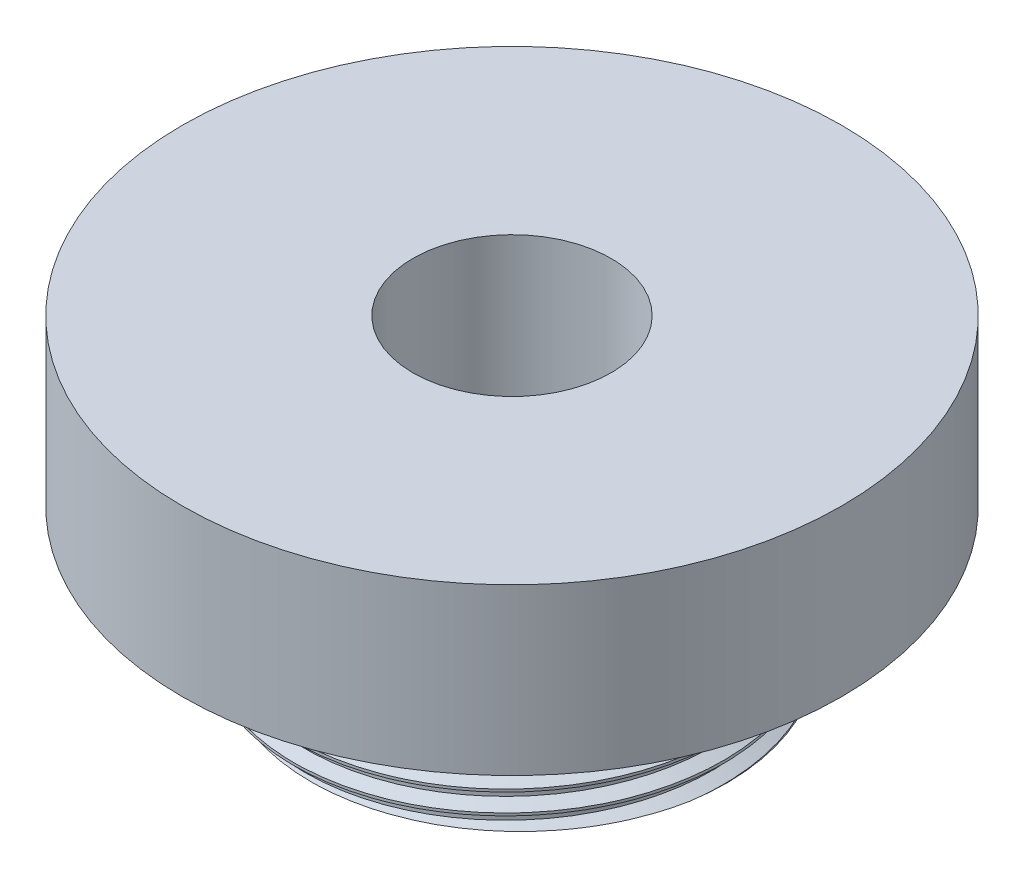
from build123d import *

# Parameters (mm, degrees)
SKETCH1_R           = 16.51
BOSS_EXTRUDE1_DEPTH = 10.16
THREAD1_PITCH       = 1.5875
SKETCH4_R           = 25.341201179
BOSS_EXTRUDE2_DEPTH = 12.7
SKETCH5_R           = 7.62
CUT_EXTRUDE1_DEPTH  = 25.4


with BuildPart() as part:
    # Sketch1 → Boss-Extrude1 (new body)
    with BuildSketch(Plane(origin=(0, 0, 0), x_dir=(1, 0, 0), z_dir=(0, 1, 0))):
        with Locations(Location((0, 0, 0), (0, 0, 270))):
            Circle(SKETCH1_R)
    extrude(amount=BOSS_EXTRUDE1_DEPTH)

    # Thread1: the profile of Thread Profile1 profile screwed along a right-hand helix of 6.299213 turns, 8 arcs to a turn; built about Z, then put on its axis
    thread1_z = Axis((0, 0, 0), (0, 0, 1))
    thread1_corners = [(16.5103, 0, -0.000173205), (16.5103, 0, 1.389235701), (15.650740423, 0, 0.892968748), (15.650740423, 0, 0.496093748)]
    with BuildLine(mode=Mode.PRIVATE) as thread1_profile:
        Line(thread1_corners[0], thread1_corners[1])
        Line(thread1_corners[1], thread1_corners[2])
        Line(thread1_corners[2], thread1_corners[3])
        Line(thread1_corners[3], thread1_corners[0])
    thread1_cap = Face(thread1_profile.wire())
    thread1_turn_angles = [0, 22.5, 45, 67.5, 90, 112.5, 135, 157.5, 180, 202.5, 225, 247.5, 270, 292.5, 315, 337.5, 360]
    thread1_turn_weights = [1, 0.9238795325112867, 1, 0.9238795325112867, 1, 0.9238795325112867, 1, 0.9238795325112867, 1, 0.9238795325112867, 1, 0.9238795325112867, 1, 0.9238795325112867, 1, 0.9238795325112867, 1]
    thread1_turn_rails = [Edge.make_bspline([Vector(p[0], p[1], 0).rotate(thread1_z, thread1_turn_angles[k]) / thread1_turn_weights[k] + Vector(0, 0, p[2] + THREAD1_PITCH * thread1_turn_angles[k] / 360) for k in range(17)], [0, 0, 0, 1, 1, 2, 2, 3, 3, 4, 4, 5, 5, 6, 6, 7, 7, 8, 8, 8], 2, thread1_turn_weights) for p in thread1_corners]
    thread1_turn_sides = [Face.make_surface_from_curves(thread1_turn_rails[p[0]], thread1_turn_rails[p[1]]) for p in [(0, 1), (1, 2), (2, 3), (3, 0)]]
    thread1_last_angles = [2160, 2182.5, 2205, 2227.5, 2250, 2258.858267717, 2267.716535433]
    thread1_last_weights = [1, 0.9238795325112867, 1, 0.9238795325112867, 1, 0.988072289441528, 1]
    thread1_last_rails = [Edge.make_bspline([Vector(p[0], p[1], 0).rotate(thread1_z, thread1_last_angles[k]) / thread1_last_weights[k] + Vector(0, 0, p[2] + THREAD1_PITCH * thread1_last_angles[k] / 360) for k in range(7)], [0, 0, 0, 1, 1, 2, 2, 3, 3, 3], 2, thread1_last_weights) for p in thread1_corners]
    thread1_last_sides = [Face.make_surface_from_curves(thread1_last_rails[p[0]], thread1_last_rails[p[1]]) for p in [(0, 1), (1, 2), (2, 3), (3, 0)]]
    thread1 = Plane(origin=(0, 10.16, 0), x_dir=(-1, 0, 0), z_dir=(0, -1, 0)) * Solid(Shell([*[p.moved(Location((0, 0, THREAD1_PITCH * i))) for i in range(6) for p in thread1_turn_sides], *thread1_last_sides, thread1_cap, thread1_cap.rotate(thread1_z, 2267.716535433).moved(Location((0, 0, THREAD1_PITCH * 2267.716535433 / 360)))]))
    add(thread1, mode=Mode.SUBTRACT)

    # Sketch4 → Boss-Extrude2 (add)
    with BuildSketch(Plane(origin=(0, 10.16, 0), x_dir=(1, 0, 0), z_dir=(0, 1, 0))):
        with Locations(Location((0, 0, 0), (0, 0, 270))):
            Circle(SKETCH4_R)
    extrude(amount=BOSS_EXTRUDE2_DEPTH)

    # Sketch5 → Cut-Extrude1 (cut)
    with BuildSketch(Plane(origin=(0, 22.86, 0), x_dir=(1, 0, 0), z_dir=(0, 1, 0))):
        with Locations(Location((0, 0, 0), (0, 0, 270))):
            Circle(SKETCH5_R)
    extrude(amount=-CUT_EXTRUDE1_DEPTH, mode=Mode.SUBTRACT)


solid = part.part
